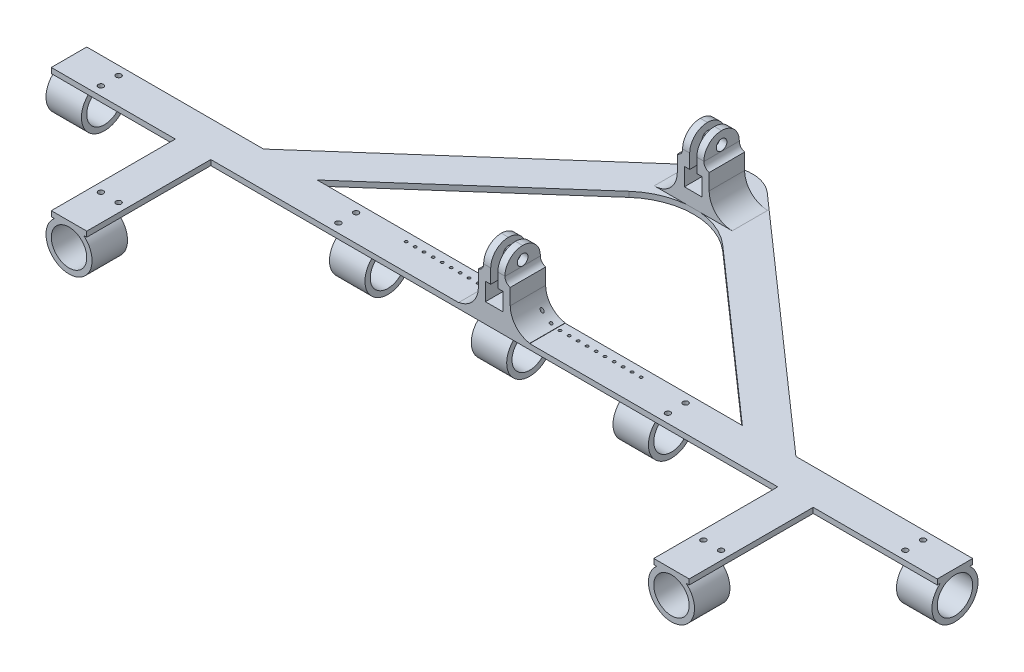
from build123d import *

# Parameters (mm, degrees)
SKETCH_1_W                = 250
SKETCH_1_H                = 10
EXTRUDE_1_DEPTH           = 1.5
SKETCH_4_W                = 10
SKETCH_4_H                = 14.267319592
EXTRUDE_3_DEPTH           = 11.5
SKETCH_5_R                = 5
CUT_EXTRUDE_1_DEPTH       = 131.702483152
SKETCH_6_W                = 10
SKETCH_6_H                = 13
EXTRUDE_4_DEPTH           = 11.5
SKETCH_7_R                = 5
CUT_EXTRUDE_2_DEPTH       = 171.512462888
SKETCH_8_W                = 10
SKETCH_8_H                = 13
EXTRUDE_5_DEPTH           = 11.5
SKETCH_9_R                = 5
CUT_EXTRUDE_3_DEPTH       = 251.348756737
SKETCH_13_W               = 10
SKETCH_13_H               = 13
EXTRUDE_6_DEPTH           = 11.5
SKETCH_15_R               = 5
CUT_EXTRUDE_5_DEPTH       = 171.512462888
SKETCH_16_W               = 10
SKETCH_16_H               = 13
EXTRUDE_7_DEPTH           = 11.5
SKETCH_17_R               = 5
CUT_EXTRUDE_6_DEPTH       = 251.348756737
CUT_EXTRUDE_8_DEPTH       = 126.696061991
EXTRUDE_10_DEPTH          = 1.5
FILLET_1_R                = 10
FILLET_2_R                = 20
SKETCH_24_W               = 20
SKETCH_24_H               = 10
EXTRUDE_11_DEPTH          = 20
SKETCH_26_W               = 22
SKETCH_26_H               = 10
EXTRUDE_12_DEPTH          = 20
SKETCH_41_W               = 10
SKETCH_41_H               = 1.5
EXTRUDE_13_DEPTH          = 35
SKETCH_42_W               = 10
SKETCH_42_H               = 1.5
EXTRUDE_14_DEPTH          = 35
EXTRUDE_21_DEPTH          = 10
SKETCH_44_R               = 6.5
SKETCH_44_R_2             = 5
EXTRUDE_22_DEPTH          = 10
SKETCH_45_R               = 0.75
CUT_EXTRUDE_37_DEPTH      = 144.873905857
SKETCH_52_R               = 0.4
CUT_EXTRUDE_47_DEPTH      = 144.873905857
SKETCH_53_W               = 5
SKETCH_53_H               = 5
SKETCH_53_W_2             = 2
SKETCH_53_H_2             = 2
CUT_EXTRUDE_49_DEPTH      = 147.300550405
FILLET_3_R                = 5
CUT_EXTRUDE_50_DEPTH      = 147.207731624
CUT_EXTRUDE_50_DEPTH_BACK = 147.207731624
SKETCH_55_R               = 1.5
SKETCH_56_R               = 1.5
CUT_EXTRUDE_51_DEPTH      = 147.207731624
FILLET_4_R                = 2


with BuildPart() as part:
    # 草图1 → 凸台-拉伸1 (new body)
    with BuildSketch(Plane(origin=(0, 0, 0), x_dir=(1, 0, 0), z_dir=(0, 1, 0))):
        Rectangle(SKETCH_1_W, SKETCH_1_H)
    extrude(amount=EXTRUDE_1_DEPTH)

    # 草图4 → 凸台-拉伸3 (add)
    with BuildSketch(Plane.XZ):
        Rectangle(SKETCH_4_W, SKETCH_4_H)
    extrude(amount=EXTRUDE_3_DEPTH)

    # 草图5 → 切除-拉伸1 (cut, through all)
    with BuildSketch(Plane(origin=(5, 0, 0), x_dir=(0, 0, -1), z_dir=(1, 0, 0))):
        with Locations(Location((0, -5, 0), (0, 0, 90))):
            Circle(SKETCH_5_R)
        with BuildLine():
            Line((7.133659796, 0), (4.153311931, 0))
            ThreePointArc((4.153311931, 0), (6.11350963, -7.207940217), (0, -11.5))
            Line((0, -11.5), (7.133659796, -11.5))
            Line((7.133659796, -11.5), (7.133659796, 0))
        make_face()
        with BuildLine():
            ThreePointArc((0, -11.5), (-6.11350963, -7.207940217), (-4.153311931, 0))
            Line((-4.153311931, 0), (-7.133659796, 0))
            Line((-7.133659796, 0), (-7.133659796, -11.5))
            Line((-7.133659796, -11.5), (0, -11.5))
        make_face()
    extrude(amount=-CUT_EXTRUDE_1_DEPTH, mode=Mode.SUBTRACT)

    # 草图6 → 凸台-拉伸4 (add)
    with BuildSketch(Plane.XZ):
        with Locations((40, 0)):
            Rectangle(SKETCH_6_W, SKETCH_6_H)
    extrude(amount=EXTRUDE_4_DEPTH)

    # 草图7 → 切除-拉伸2 (cut, through all)
    with BuildSketch(Plane(origin=(45, 0, 0), x_dir=(0, 0, -1), z_dir=(1, 0, 0))):
        with Locations(Location((0, -5, 0), (0, 0, 90))):
            Circle(SKETCH_7_R)
        with BuildLine():
            Line((6.5, 0), (4.153311931, 0))
            ThreePointArc((4.153311931, 0), (5.884153616, -2.238345383), (6.5, -5))
            Line((6.5, -5), (6.5, 0))
        make_face()
        with BuildLine():
            ThreePointArc((-6.5, -5), (-5.884153616, -2.238345383), (-4.153311931, 0))
            Line((-4.153311931, 0), (-6.5, 0))
            Line((-6.5, 0), (-6.5, -5))
        make_face()
        with BuildLine():
            Line((6.5, -11.5), (6.5, -5))
            ThreePointArc((6.5, -5), (4.596194078, -9.596194078), (0, -11.5))
            Line((0, -11.5), (6.5, -11.5))
        make_face()
        with BuildLine():
            ThreePointArc((0, -11.5), (-4.596194078, -9.596194078), (-6.5, -5))
            Line((-6.5, -5), (-6.5, -11.5))
            Line((-6.5, -11.5), (0, -11.5))
        make_face()
    extrude(amount=-CUT_EXTRUDE_2_DEPTH, mode=Mode.SUBTRACT)

    # 草图8 → 凸台-拉伸5 (add)
    with BuildSketch(Plane.XZ):
        with Locations((120, 0)):
            Rectangle(SKETCH_8_W, SKETCH_8_H)
    extrude(amount=EXTRUDE_5_DEPTH)

    # 草图9 → 切除-拉伸3 (cut, through all)
    with BuildSketch(Plane(origin=(125, 0, 0), x_dir=(0, 0, -1), z_dir=(1, 0, 0))):
        with BuildLine():
            Line((-4.153311931, 0), (-6.5, 0))
            Line((-6.5, 0), (-6.5, -5))
            ThreePointArc((-6.5, -5), (-5.884153616, -2.238345383), (-4.153311931, 0))
        make_face()
        with Locations(Location((0, -5, 0), (0, 0, 90))):
            Circle(SKETCH_9_R)
        with BuildLine():
            ThreePointArc((0, -11.5), (-4.596194078, -9.596194078), (-6.5, -5))
            Line((-6.5, -5), (-6.5, -11.5))
            Line((-6.5, -11.5), (0, -11.5))
        make_face()
        with BuildLine():
            Line((6.5, 0), (4.153311931, 0))
            ThreePointArc((4.153311931, 0), (5.884153616, -2.238345383), (6.5, -5))
            Line((6.5, -5), (6.5, 0))
        make_face()
        with BuildLine():
            ThreePointArc((6.5, -5), (4.596194078, -9.596194078), (0, -11.5))
            Line((0, -11.5), (6.5, -11.5))
            Line((6.5, -11.5), (6.5, -5))
        make_face()
    extrude(amount=-CUT_EXTRUDE_3_DEPTH, mode=Mode.SUBTRACT)

    # 草图13 → 凸台-拉伸6 (add)
    with BuildSketch(Plane.XZ):
        with Locations((-40, 0)):
            Rectangle(SKETCH_13_W, SKETCH_13_H)
    extrude(amount=EXTRUDE_6_DEPTH)

    # 草图15 → 切除-拉伸5 (cut, through all)
    with BuildSketch(Plane.ZY.offset(45)):
        with Locations(Location((0, -5, 0), (0, 0, 90))):
            Circle(SKETCH_15_R)
        with BuildLine():
            Line((6.5, 0), (4.153311931, 0))
            ThreePointArc((4.153311931, 0), (5.884153616, -2.238345383), (6.5, -5))
            Line((6.5, -5), (6.5, 0))
        make_face()
        with BuildLine():
            ThreePointArc((-6.5, -5), (-5.884153616, -2.238345383), (-4.153311931, 0))
            Line((-4.153311931, 0), (-6.5, 0))
            Line((-6.5, 0), (-6.5, -5))
        make_face()
        with BuildLine():
            Line((6.5, -11.5), (6.5, -5))
            ThreePointArc((6.5, -5), (4.596194078, -9.596194078), (0, -11.5))
            Line((0, -11.5), (6.5, -11.5))
        make_face()
        with BuildLine():
            ThreePointArc((0, -11.5), (-4.596194078, -9.596194078), (-6.5, -5))
            Line((-6.5, -5), (-6.5, -11.5))
            Line((-6.5, -11.5), (0, -11.5))
        make_face()
    extrude(amount=-CUT_EXTRUDE_5_DEPTH, mode=Mode.SUBTRACT)

    # 草图16 → 凸台-拉伸7 (add)
    with BuildSketch(Plane.XZ):
        with Locations((-120, 0)):
            Rectangle(SKETCH_16_W, SKETCH_16_H)
    extrude(amount=EXTRUDE_7_DEPTH)

    # 草图17 → 切除-拉伸6 (cut, through all)
    with BuildSketch(Plane.ZY.offset(125)):
        with BuildLine():
            Line((-4.153311931, 0), (-6.5, 0))
            Line((-6.5, 0), (-6.5, -5))
            ThreePointArc((-6.5, -5), (-5.884153616, -2.238345383), (-4.153311931, 0))
        make_face()
        with Locations(Location((0, -5, 0), (0, 0, 90))):
            Circle(SKETCH_17_R)
        with BuildLine():
            ThreePointArc((0, -11.5), (-4.596194078, -9.596194078), (-6.5, -5))
            Line((-6.5, -5), (-6.5, -11.5))
            Line((-6.5, -11.5), (0, -11.5))
        make_face()
        with BuildLine():
            Line((6.5, 0), (4.153311931, 0))
            ThreePointArc((4.153311931, 0), (5.884153616, -2.238345383), (6.5, -5))
            Line((6.5, -5), (6.5, 0))
        make_face()
        with BuildLine():
            ThreePointArc((6.5, -5), (4.596194078, -9.596194078), (0, -11.5))
            Line((0, -11.5), (6.5, -11.5))
            Line((6.5, -11.5), (6.5, -5))
        make_face()
    extrude(amount=-CUT_EXTRUDE_6_DEPTH, mode=Mode.SUBTRACT)

    # 草图18 → 切除-拉伸8 (cut, through all)
    with BuildSketch(Plane.XZ):
        with BuildLine():
            ThreePointArc((-113.5, 3.25), (-114.030330086, 3.030330086), (-114.25, 2.5))
            Line((-114.25, 2.5), (-113.5, 2.5))
            Line((-113.5, 2.5), (-113.5, 3.25))
        make_face()
        with BuildLine():
            Line((-113.5, 2.5), (-114.25, 2.5))
            ThreePointArc((-114.25, 2.5), (-114.030330086, 1.969669914), (-113.5, 1.75))
            Line((-113.5, 1.75), (-113.5, 2.5))
        make_face()
        with BuildLine():
            Line((-113.5, 3.25), (-113.5, 2.5))
            Line((-113.5, 2.5), (-112.75, 2.5))
            ThreePointArc((-112.75, 2.5), (-112.969669914, 3.030330086), (-113.5, 3.25))
        make_face()
        with BuildLine():
            Line((-112.75, 2.5), (-113.5, 2.5))
            Line((-113.5, 2.5), (-113.5, 1.75))
            ThreePointArc((-113.5, 1.75), (-112.969669914, 1.969669914), (-112.75, 2.5))
        make_face()
        with BuildLine():
            ThreePointArc((-112.75, -2.5), (-112.969669914, -1.969669914), (-113.5, -1.75))
            Line((-113.5, -1.75), (-113.5, -2.5))
            Line((-113.5, -2.5), (-112.75, -2.5))
        make_face()
        with BuildLine():
            Line((-113.5, -2.5), (-113.5, -1.75))
            ThreePointArc((-113.5, -1.75), (-114.030330086, -1.969669914), (-114.25, -2.5))
            Line((-114.25, -2.5), (-113.5, -2.5))
        make_face()
        with BuildLine():
            Line((-113.5, -3.25), (-113.5, -2.5))
            Line((-113.5, -2.5), (-114.25, -2.5))
            ThreePointArc((-114.25, -2.5), (-114.030330086, -3.030330086), (-113.5, -3.25))
        make_face()
        with BuildLine():
            Line((-112.75, -2.5), (-113.5, -2.5))
            Line((-113.5, -2.5), (-113.5, -3.25))
            ThreePointArc((-113.5, -3.25), (-112.969669914, -3.030330086), (-112.75, -2.5))
        make_face()
        with BuildLine():
            ThreePointArc((-46.5, 3.25), (-47.030330086, 3.030330086), (-47.25, 2.5))
            Line((-47.25, 2.5), (-46.5, 2.5))
            Line((-46.5, 2.5), (-46.5, 3.25))
        make_face()
        with BuildLine():
            Line((-46.5, 2.5), (-47.25, 2.5))
            ThreePointArc((-47.25, 2.5), (-47.030330086, 1.969669914), (-46.5, 1.75))
            Line((-46.5, 1.75), (-46.5, 2.5))
        make_face()
        with BuildLine():
            Line((-46.5, 3.25), (-46.5, 2.5))
            Line((-46.5, 2.5), (-45.75, 2.5))
            ThreePointArc((-45.75, 2.5), (-45.969669914, 3.030330086), (-46.5, 3.25))
        make_face()
        with BuildLine():
            Line((-45.75, 2.5), (-46.5, 2.5))
            Line((-46.5, 2.5), (-46.5, 1.75))
            ThreePointArc((-46.5, 1.75), (-45.969669914, 1.969669914), (-45.75, 2.5))
        make_face()
        with BuildLine():
            ThreePointArc((-45.75, -2.5), (-45.969669914, -1.969669914), (-46.5, -1.75))
            Line((-46.5, -1.75), (-46.5, -2.5))
            Line((-46.5, -2.5), (-45.75, -2.5))
        make_face()
        with BuildLine():
            Line((-46.5, -2.5), (-46.5, -1.75))
            ThreePointArc((-46.5, -1.75), (-47.030330086, -1.969669914), (-47.25, -2.5))
            Line((-47.25, -2.5), (-46.5, -2.5))
        make_face()
        with BuildLine():
            Line((-46.5, -3.25), (-46.5, -2.5))
            Line((-46.5, -2.5), (-47.25, -2.5))
            ThreePointArc((-47.25, -2.5), (-47.030330086, -3.030330086), (-46.5, -3.25))
        make_face()
        with BuildLine():
            Line((-45.75, -2.5), (-46.5, -2.5))
            Line((-46.5, -2.5), (-46.5, -3.25))
            ThreePointArc((-46.5, -3.25), (-45.969669914, -3.030330086), (-45.75, -2.5))
        make_face()
        with BuildLine():
            ThreePointArc((-6.5, 1.75), (-5.969669914, 1.969669914), (-5.75, 2.5))
            Line((-5.75, 2.5), (-6.5, 2.5))
            Line((-6.5, 2.5), (-6.5, 1.75))
        make_face()
        with BuildLine():
            Line((-6.5, 2.5), (-5.75, 2.5))
            ThreePointArc((-5.75, 2.5), (-5.969669914, 3.030330086), (-6.5, 3.25))
            Line((-6.5, 3.25), (-6.5, 2.5))
        make_face()
        with BuildLine():
            Line((-6.5, 1.75), (-6.5, 2.5))
            Line((-6.5, 2.5), (-7.25, 2.5))
            ThreePointArc((-7.25, 2.5), (-7.030330086, 1.969669914), (-6.5, 1.75))
        make_face()
        with BuildLine():
            Line((-7.25, 2.5), (-6.5, 2.5))
            Line((-6.5, 2.5), (-6.5, 3.25))
            ThreePointArc((-6.5, 3.25), (-7.030330086, 3.030330086), (-7.25, 2.5))
        make_face()
        with BuildLine():
            ThreePointArc((-5.75, -2.5), (-5.969669914, -1.969669914), (-6.5, -1.75))
            Line((-6.5, -1.75), (-6.5, -2.5))
            Line((-6.5, -2.5), (-5.75, -2.5))
        make_face()
        with BuildLine():
            Line((-6.5, -2.5), (-6.5, -1.75))
            ThreePointArc((-6.5, -1.75), (-7.030330086, -1.969669914), (-7.25, -2.5))
            Line((-7.25, -2.5), (-6.5, -2.5))
        make_face()
        with BuildLine():
            Line((-6.5, -3.25), (-6.5, -2.5))
            Line((-6.5, -2.5), (-7.25, -2.5))
            ThreePointArc((-7.25, -2.5), (-7.030330086, -3.030330086), (-6.5, -3.25))
        make_face()
        with BuildLine():
            Line((-5.75, -2.5), (-6.5, -2.5))
            Line((-6.5, -2.5), (-6.5, -3.25))
            ThreePointArc((-6.5, -3.25), (-5.969669914, -3.030330086), (-5.75, -2.5))
        make_face()
        with BuildLine():
            ThreePointArc((45.75, 2.5), (45.969669914, 1.969669914), (46.5, 1.75))
            Line((46.5, 1.75), (46.5, 2.5))
            Line((46.5, 2.5), (45.75, 2.5))
        make_face()
        with BuildLine():
            Line((46.5, 2.5), (46.5, 1.75))
            ThreePointArc((46.5, 1.75), (47.030330086, 1.969669914), (47.25, 2.5))
            Line((47.25, 2.5), (46.5, 2.5))
        make_face()
        with BuildLine():
            Line((46.5, 3.25), (46.5, 2.5))
            Line((46.5, 2.5), (47.25, 2.5))
            ThreePointArc((47.25, 2.5), (47.030330086, 3.030330086), (46.5, 3.25))
        make_face()
        with BuildLine():
            Line((45.75, 2.5), (46.5, 2.5))
            Line((46.5, 2.5), (46.5, 3.25))
            ThreePointArc((46.5, 3.25), (45.969669914, 3.030330086), (45.75, 2.5))
        make_face()
        with BuildLine():
            ThreePointArc((46.5, -3.25), (47.030330086, -3.030330086), (47.25, -2.5))
            Line((47.25, -2.5), (46.5, -2.5))
            Line((46.5, -2.5), (46.5, -3.25))
        make_face()
        with BuildLine():
            Line((46.5, -2.5), (47.25, -2.5))
            ThreePointArc((47.25, -2.5), (47.030330086, -1.969669914), (46.5, -1.75))
            Line((46.5, -1.75), (46.5, -2.5))
        make_face()
        with BuildLine():
            Line((46.5, -3.25), (46.5, -2.5))
            Line((46.5, -2.5), (45.75, -2.5))
            ThreePointArc((45.75, -2.5), (45.969669914, -3.030330086), (46.5, -3.25))
        make_face()
        with BuildLine():
            Line((45.75, -2.5), (46.5, -2.5))
            Line((46.5, -2.5), (46.5, -1.75))
            ThreePointArc((46.5, -1.75), (45.969669914, -1.969669914), (45.75, -2.5))
        make_face()
        with BuildLine():
            ThreePointArc((112.75, 2.5), (112.969669914, 1.969669914), (113.5, 1.75))
            Line((113.5, 1.75), (113.5, 2.5))
            Line((113.5, 2.5), (112.75, 2.5))
        make_face()
        with BuildLine():
            Line((113.5, 2.5), (113.5, 1.75))
            ThreePointArc((113.5, 1.75), (114.030330086, 1.969669914), (114.25, 2.5))
            Line((114.25, 2.5), (113.5, 2.5))
        make_face()
        with BuildLine():
            Line((113.5, 3.25), (113.5, 2.5))
            Line((113.5, 2.5), (114.25, 2.5))
            ThreePointArc((114.25, 2.5), (114.030330086, 3.030330086), (113.5, 3.25))
        make_face()
        with BuildLine():
            Line((112.75, 2.5), (113.5, 2.5))
            Line((113.5, 2.5), (113.5, 3.25))
            ThreePointArc((113.5, 3.25), (112.969669914, 3.030330086), (112.75, 2.5))
        make_face()
        with BuildLine():
            ThreePointArc((113.5, -3.25), (114.030330086, -3.030330086), (114.25, -2.5))
            Line((114.25, -2.5), (113.5, -2.5))
            Line((113.5, -2.5), (113.5, -3.25))
        make_face()
        with BuildLine():
            Line((113.5, -2.5), (114.25, -2.5))
            ThreePointArc((114.25, -2.5), (114.030330086, -1.969669914), (113.5, -1.75))
            Line((113.5, -1.75), (113.5, -2.5))
        make_face()
        with BuildLine():
            Line((113.5, -3.25), (113.5, -2.5))
            Line((113.5, -2.5), (112.75, -2.5))
            ThreePointArc((112.75, -2.5), (112.969669914, -3.030330086), (113.5, -3.25))
        make_face()
        with BuildLine():
            Line((112.75, -2.5), (113.5, -2.5))
            Line((113.5, -2.5), (113.5, -1.75))
            ThreePointArc((113.5, -1.75), (112.969669914, -1.969669914), (112.75, -2.5))
        make_face()
    extrude(amount=-CUT_EXTRUDE_8_DEPTH, mode=Mode.SUBTRACT)



with BuildPart() as body_2:
    # 草图22 → 凸台-拉伸10 (new body)
    with BuildSketch(Plane.XZ):
        Polygon((0, -71.248359555), (0, -57.915026221), (-60, -5), (-75.11857892, -5), align=None)
        Polygon((60, -5), (0, -57.915026221), (0, -71.248359555), (75.11857892, -5), align=None)
    extrude(amount=-EXTRUDE_10_DEPTH)

    # 圆角1
    fillet_1_edges = [body_2.edges().sort_by_distance(p)[0] for p in [
        (0, 0.75, -71.248359555),
    ]]
    fillet(fillet_1_edges, radius=FILLET_1_R)

    # 圆角2
    fillet_2_edges = [body_2.edges().sort_by_distance(p)[0] for p in [
        (0, 0.75, -57.915026221),
    ]]
    fillet(fillet_2_edges, radius=FILLET_2_R)


with BuildPart() as part_1:
    add(part.part)

    add(body_2.part)  # 凸台-拉伸11 merges body 2
    # 草图24 → 凸台-拉伸11 (add)
    with BuildSketch(Plane(origin=(0, 1.5, 0), x_dir=(1, 0, 0), z_dir=(0, 1, 0))):
        Rectangle(SKETCH_24_W, SKETCH_24_H)
    extrude(amount=EXTRUDE_11_DEPTH)

    # 草图26 → 凸台-拉伸12 (add)
    with BuildSketch(Plane(origin=(0, 1.5, 0), x_dir=(1, 0, 0), z_dir=(0, 1, 0))):
        with Locations((0, 56.141850112)):
            Rectangle(SKETCH_26_W, SKETCH_26_H)
    extrude(amount=EXTRUDE_12_DEPTH)

    # 草图41 → 凸台-拉伸13 (add)
    with BuildSketch(Plane.XY.offset(5)):
        with Locations((85, 0.75)):
            Rectangle(SKETCH_41_W, SKETCH_41_H)
    extrude(amount=EXTRUDE_13_DEPTH)

    # 草图42 → 凸台-拉伸14 (add)
    with BuildSketch(Plane.XY.offset(5)):
        with Locations((-85, 0.75)):
            Rectangle(SKETCH_42_W, SKETCH_42_H)
    extrude(amount=EXTRUDE_14_DEPTH)

    # 草图43 → 凸台-拉伸21 (add)
    # profile 1 of 5: a face of its own
    with BuildSketch(Plane.XY.offset(40)):
        with BuildLine():
            Line((89.153311931, 0), (85, 0))
            Line((85, 0), (80.846688069, 0))
            ThreePointArc((80.846688069, 0), (82.238345383, -10.884153616), (91.5, -5))
            ThreePointArc((91.5, -5), (90.884153616, -2.238345383), (89.153311931, 0))
        make_face()
        with BuildLine():
            ThreePointArc((90, -5), (81.464466094, -8.535533906), (85, 0))
            ThreePointArc((85, 0), (88.535533906, -1.464466094), (90, -5))
        make_face(mode=Mode.SUBTRACT)
    # profile 2 of 5: a face of its own
    with BuildSketch(Plane.XY.offset(40)):
        with BuildLine():
            Line((80.846688069, 0), (85, 0))
            Line((85, 0), (85, 1.5))
            ThreePointArc((85, 1.5), (82.792059783, 1.11350963), (80.846688069, 0))
        make_face()
    # profile 3 of 5: a face of its own
    with BuildSketch(Plane.XY.offset(40)):
        with BuildLine():
            Line((85, 1.5), (85, 0))
            Line((85, 0), (89.153311931, 0))
            ThreePointArc((89.153311931, 0), (87.207940217, 1.11350963), (85, 1.5))
        make_face()
    # profile 4 of 5: a face of its own
    with BuildSketch(Plane.XY.offset(40)):
        with BuildLine():
            Line((80.846688069, 0), (85, 0))
            Line((85, 0), (85, 1.5))
            ThreePointArc((85, 1.5), (82.792059783, 1.11350963), (80.846688069, 0))
        make_face()
    # profile 5 of 5: a face of its own
    with BuildSketch(Plane.XY.offset(40)):
        with BuildLine():
            Line((85, 1.5), (85, 0))
            Line((85, 0), (89.153311931, 0))
            ThreePointArc((89.153311931, 0), (87.207940217, 1.11350963), (85, 1.5))
        make_face()
    extrude(amount=-EXTRUDE_21_DEPTH)

    # 草图44 → 凸台-拉伸22 (add)
    with BuildSketch(Plane.XY.offset(40)):
        with Locations((-85, -5)):
            Circle(SKETCH_44_R)
        with Locations((-85, -5)):
            Circle(SKETCH_44_R_2, mode=Mode.SUBTRACT)
    extrude(amount=-EXTRUDE_22_DEPTH)

    # 草图45 → 切除-拉伸37 (cut, through all)
    with BuildSketch(Plane.XZ):
        with BuildLine():
            ThreePointArc((-86.75, 28.5), (-86.969669914, 29.030330086), (-87.5, 29.25))
            Line((-87.5, 29.25), (-87.5, 28.5))
            Line((-87.5, 28.5), (-86.75, 28.5))
        make_face()
        with BuildLine():
            Line((-87.5, 28.5), (-87.5, 29.25))
            ThreePointArc((-87.5, 29.25), (-88.030330086, 29.030330086), (-88.25, 28.5))
            Line((-88.25, 28.5), (-87.5, 28.5))
        make_face()
        with BuildLine():
            Line((-86.75, 28.5), (-87.5, 28.5))
            Line((-87.5, 28.5), (-87.5, 27.75))
            ThreePointArc((-87.5, 27.75), (-86.969669914, 27.969669914), (-86.75, 28.5))
        make_face()
        with BuildLine():
            Line((-87.5, 27.75), (-87.5, 28.5))
            Line((-87.5, 28.5), (-88.25, 28.5))
            ThreePointArc((-88.25, 28.5), (-88.030330086, 27.969669914), (-87.5, 27.75))
        make_face()
        with BuildLine():
            ThreePointArc((-82.5, 29.25), (-83.030330086, 29.030330086), (-83.25, 28.5))
            Line((-83.25, 28.5), (-82.5, 28.5))
            Line((-82.5, 28.5), (-82.5, 29.25))
        make_face()
        with BuildLine():
            Line((-82.5, 28.5), (-83.25, 28.5))
            ThreePointArc((-83.25, 28.5), (-83.030330086, 27.969669914), (-82.5, 27.75))
            Line((-82.5, 27.75), (-82.5, 28.5))
        make_face()
        with BuildLine():
            Line((-81.75, 28.5), (-82.5, 28.5))
            Line((-82.5, 28.5), (-82.5, 27.75))
            ThreePointArc((-82.5, 27.75), (-81.969669914, 27.969669914), (-81.75, 28.5))
        make_face()
        with BuildLine():
            Line((-82.5, 29.25), (-82.5, 28.5))
            Line((-82.5, 28.5), (-81.75, 28.5))
            ThreePointArc((-81.75, 28.5), (-81.969669914, 29.030330086), (-82.5, 29.25))
        make_face()
        with Locations(Location((82.5, 28.5, 0), (0, 0, 270))):
            Circle(SKETCH_45_R)
        with Locations(Location((87.5, 28.5, 0), (0, 0, 270))):
            Circle(SKETCH_45_R)
    extrude(amount=-CUT_EXTRUDE_37_DEPTH, mode=Mode.SUBTRACT)

    # 草图52 → 切除-拉伸47 (cut, through all)
    with BuildSketch(Plane.XZ):
        with Locations(Location((-9.5, -2.5, 0), (0, 0, 270))):
            Circle(SKETCH_52_R)
        with Locations(Location((-12.04, -2.5, 0), (0, 0, 270))):
            Circle(SKETCH_52_R)
        with Locations(Location((-14.58, -2.5, 0), (0, 0, 270))):
            Circle(SKETCH_52_R)
        with Locations(Location((-17.12, -2.5, 0), (0, 0, 270))):
            Circle(SKETCH_52_R)
        with Locations(Location((-19.66, -2.5, 0), (0, 0, 270))):
            Circle(SKETCH_52_R)
        with Locations(Location((-22.2, -2.5, 0), (0, 0, 270))):
            Circle(SKETCH_52_R)
        with Locations(Location((-24.74, -2.5, 0), (0, 0, 270))):
            Circle(SKETCH_52_R)
        with Locations(Location((-27.28, -2.5, 0), (0, 0, 270))):
            Circle(SKETCH_52_R)
        with Locations(Location((-29.82, -2.5, 0), (0, 0, 270))):
            Circle(SKETCH_52_R)
        with Locations(Location((-32.36, -2.5, 0), (0, 0, 270))):
            Circle(SKETCH_52_R)
        with Locations(Location((6, -2.5, 0), (0, 0, 270))):
            Circle(SKETCH_52_R)
        with Locations(Location((8.54, -2.5, 0), (0, 0, 270))):
            Circle(SKETCH_52_R)
        with Locations(Location((11.08, -2.5, 0), (0, 0, 270))):
            Circle(SKETCH_52_R)
        with Locations(Location((13.62, -2.5, 0), (0, 0, 270))):
            Circle(SKETCH_52_R)
        with Locations(Location((16.16, -2.5, 0), (0, 0, 270))):
            Circle(SKETCH_52_R)
        with Locations(Location((18.7, -2.5, 0), (0, 0, 270))):
            Circle(SKETCH_52_R)
        with Locations(Location((21.24, -2.5, 0), (0, 0, 270))):
            Circle(SKETCH_52_R)
        with Locations(Location((23.78, -2.5, 0), (0, 0, 270))):
            Circle(SKETCH_52_R)
        with Locations(Location((26.32, -2.5, 0), (0, 0, 270))):
            Circle(SKETCH_52_R)
        with Locations(Location((28.86, -2.5, 0), (0, 0, 270))):
            Circle(SKETCH_52_R)
        with Locations(Location((31.4, -2.5, 0), (0, 0, 270))):
            Circle(SKETCH_52_R)
        with Locations(Location((33.94, -2.5, 0), (0, 0, 270))):
            Circle(SKETCH_52_R)
    extrude(amount=-CUT_EXTRUDE_47_DEPTH, mode=Mode.SUBTRACT)

    # 草图53 → 切除-拉伸49 (cut, through all)
    with BuildSketch(Plane.XY.offset(5)):
        with BuildLine():
            Line((-1, 19.5), (-1, 12.5))
            Line((-1, 12.5), (1, 12.5))
            Line((1, 12.5), (1, 19.5))
            Line((1, 19.5), (3, 19.5))
            Line((3, 19.5), (3, 12.5))
            Line((3, 12.5), (4.5, 12.5))
            Line((4.5, 12.5), (4.5, 8))
            ThreePointArc((4.5, 8), (6.062895585, 3.772116369), (10, 1.577383711))
            Line((10, 1.577383711), (10, 21.5))
            Line((10, 21.5), (-10, 21.5))
            Line((-10, 21.5), (-10, 1.577383711))
            ThreePointArc((-10, 1.577383711), (-6.062895585, 3.772116369), (-4.5, 8))
            Line((-4.5, 8), (-4.5, 12.5))
            Line((-4.5, 12.5), (-3, 12.5))
            Line((-3, 12.5), (-3, 19.5))
            Line((-3, 19.5), (-1, 19.5))
        make_face()
        with Locations((0, 8)):
            Rectangle(SKETCH_53_W, SKETCH_53_H)
        with Locations((0, 11.5)):
            Rectangle(SKETCH_53_W_2, SKETCH_53_H_2)
        with BuildLine():
            ThreePointArc((-11, 1.5), (-10.498505175, 1.519374803), (-10, 1.577383711))
            Line((-10, 1.577383711), (-10, 21.5))
            Line((-10, 21.5), (-11, 21.5))
            Line((-11, 21.5), (-11, 1.5))
        make_face()
        with BuildLine():
            Line((10, 21.5), (10, 1.577383711))
            ThreePointArc((10, 1.577383711), (10.498505175, 1.519374803), (11, 1.5))
            Line((11, 1.5), (11, 21.5))
            Line((11, 21.5), (10, 21.5))
        make_face()
    extrude(amount=-CUT_EXTRUDE_49_DEPTH, mode=Mode.SUBTRACT)

    # 圆角3
    # the kernel refuses this fillet: 5 mm, written as the material it takes off along each edge
    with BuildSketch(Plane(origin=(-15.5, 19.5, -51.141850112), x_dir=(0, -1, 0), z_dir=(1, 0, 0)), Plane(origin=(-11.5, 19.5, -51.141850112), x_dir=(0, -1, 0), z_dir=(1, 0, 0)), Plane(origin=(-11.5, 19.5, 5), x_dir=(0, -1, 0), z_dir=(1, 0, 0)), Plane(origin=(15.5, 19.5, -5), x_dir=(0, -1, 0), z_dir=(-1, 0, 0)), Plane(origin=(15.5, 19.5, -61.141850112), x_dir=(0, -1, 0), z_dir=(-1, 0, 0)), Plane(origin=(-15.5, 19.5, 5), x_dir=(0, -1, 0), z_dir=(1, 0, 0)), Plane(origin=(11.5, 19.5, -61.141850112), x_dir=(0, -1, 0), z_dir=(-1, 0, 0)), Plane(origin=(11.5, 19.5, -5), x_dir=(0, -1, 0), z_dir=(-1, 0, 0))) as fillet_3_piece_1:
        with BuildLine():
            CenterArc((FILLET_3_R, FILLET_3_R), FILLET_3_R, 180, 90)
            Line((0, FILLET_3_R), (0, 0))
            Line((0, 0), (FILLET_3_R, 0))
        make_face()
    extrude(amount=27, mode=Mode.SUBTRACT)

    # 草图55 → 切除-拉伸50 (cut, two sides: drawn at the far end of the back side and taken through both)
    with BuildSketch(Plane(origin=(3, 0, 0), x_dir=(0, 0, -1), z_dir=(1, 0, 0)).offset(-CUT_EXTRUDE_50_DEPTH_BACK)):
        with Locations((0, 16)):
            Circle(SKETCH_55_R)
    extrude(amount=CUT_EXTRUDE_50_DEPTH + CUT_EXTRUDE_50_DEPTH_BACK, mode=Mode.SUBTRACT)

    # 草图56 → 切除-拉伸51 (cut, through all)
    with BuildSketch(Plane(origin=(3, 0, 0), x_dir=(0, 0, -1), z_dir=(1, 0, 0))):
        with Locations((56.141850112, 16)):
            Circle(SKETCH_56_R)
    extrude(amount=-CUT_EXTRUDE_51_DEPTH, mode=Mode.SUBTRACT)

    # 圆角4
    # the kernel refuses this fillet: 2 mm, written as the material it adds along each edge
    with BuildSketch(Plane(origin=(-3, 12.5, -51.141850112), x_dir=(-1, 0, 0), z_dir=(0, 0, -1)), Plane(origin=(-3, 12.5, 5), x_dir=(-1, 0, 0), z_dir=(0, 0, -1))) as fillet_4_piece_1:
        with BuildLine():
            CenterArc((2, 1.936491673), FILLET_4_R, 180, 75.522487814)
            Line((0, 1.936491673), (-0.04, 1.936491673))
            Line((-0.04, 1.936491673), (-0.04, 0))
            Line((-0.04, 0), (0, -0.04))
            ThreePointArc((0, -0.04), (0.75, -0.04), (1.49, -0.038729833))
            Line((1.49, -0.038729833), (1.5, 0))
        make_face()
    extrude(amount=10)
    with BuildSketch(Plane(origin=(3, 12.5, -51.141850112), x_dir=(0, 1, 0), z_dir=(0, 0, -1)), Plane(origin=(3, 12.5, 5), x_dir=(0, 1, 0), z_dir=(0, 0, -1))) as fillet_4_piece_2:
        with BuildLine():
            CenterArc((1.936491673, 2), FILLET_4_R, 194.477512186, 75.522487814)
            Line((0, 1.5), (-0.038729833, 1.49))
            ThreePointArc((-0.038729833, 1.49), (-0.04, 0.75), (-0.04, 0))
            Line((-0.04, 0), (0, -0.04))
            Line((0, -0.04), (1.936491673, -0.04))
            Line((1.936491673, -0.04), (1.936491673, 0))
        make_face()
    extrude(amount=10)


solid = part_1.part
